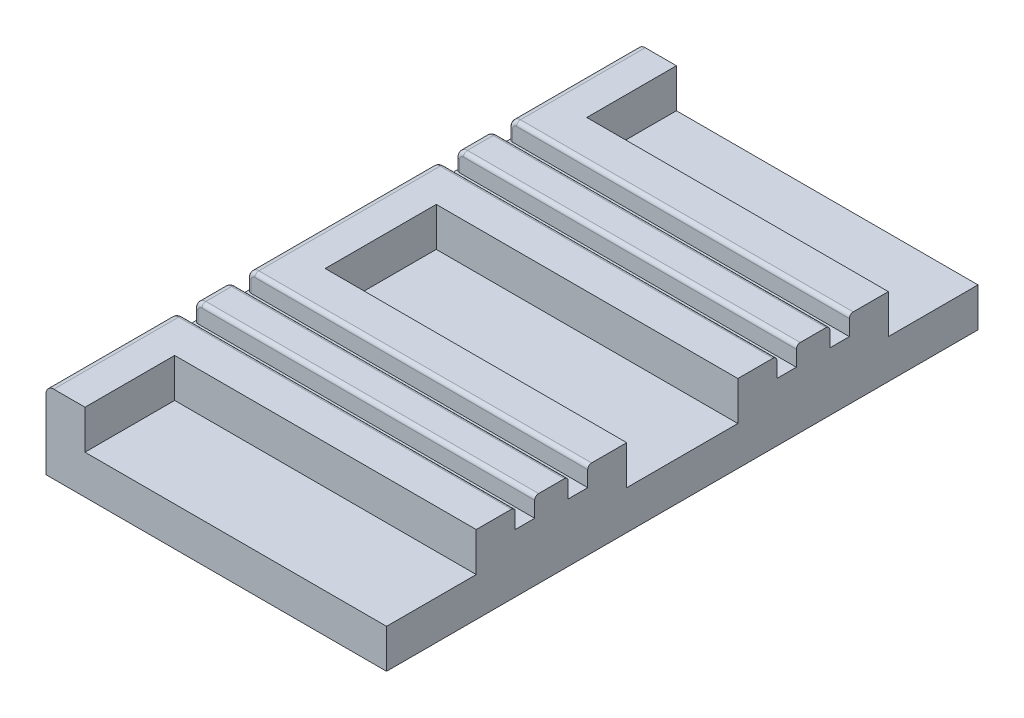
from build123d import *

# Parameters (mm, degrees)
SKETCH1_W                                  = 240
SKETCH1_H                                  = 200
BOSS_EXTRUDE1_DEPTH                        = 20
SKETCH7_W                                  = 120
SKETCH7_H                                  = 50
BOSS_EXTRUDE6_DEPTH                        = 20
FILLET1_R                                  = 2
SKETCH2_W                                  = 39.3
SKETCH2_H                                  = 125.7
CUT_EXTRUDE1_DEPTH                         = 10
CUT_EXTRUDE3_DEPTH                         = 5
MIRROR4_AT_THE_SECOND_PLANE_COPY_1_DEPTH   = 5
SKETCH11_W                                 = 104.748042719
SKETCH11_H                                 = 5
CUT_EXTRUDE4_DEPTH                         = 5
MIRROR6_AT_THE_SECOND_PLANE_COPY_1_SKETC_W = 104.748042719
MIRROR6_AT_THE_SECOND_PLANE_COPY_1_SKETC_H = 5
MIRROR6_AT_THE_SECOND_PLANE_COPY_1_DEPTH   = 5
SHELL1_START                               = 10
SHELL1_OUTLINE_W                           = 80.35
SHELL1_OUTLINE_H                           = 28.5
SHELL1_DEPTH                               = 10
FILLET3_R                                  = 1
SKETCH13_W                                 = 7.252545243
SKETCH13_H                                 = 2.335565418
SKETCH13_W_2                               = 1.720942939
SKETCH13_H_2                               = 2.581414408
CUT_EXTRUDE5_DEPTH                         = 2
CUT_EXTRUDE6_DEPTH                         = 10
MIRROR7_AT_THE_SECOND_PLANE_COPY_1_DEPTH   = 10
SKETCH15_W                                 = 101.789001661
SKETCH15_H                                 = 87.14110882
CUT_EXTRUDE7_DEPTH                         = 194.132079158
SKETCH16_W                                 = 160.143350343
SKETCH16_H                                 = 312.615723006
CUT_EXTRUDE9_DEPTH                         = 194.132079158


# Read off the part's stored shape, not the designer's step: Shell1
with BuildPart() as part:
    # Sketch1 → Boss-Extrude1 (new body)
    with BuildSketch(Plane(origin=(0, 0, 0), x_dir=(1, 0, 0), z_dir=(0, 1, 0))):
        Rectangle(SKETCH1_W, SKETCH1_H)
    extrude(amount=BOSS_EXTRUDE1_DEPTH)

    # Sketch7 → Boss-Extrude6 (add)
    with BuildSketch(Plane(origin=(0, 0, 0), x_dir=(1, 0, 0), z_dir=(0, 1, 0))):
        with Locations((0, 125)):
            Rectangle(SKETCH7_W, SKETCH7_H)
        with Locations((0, -125)):
            Rectangle(SKETCH7_W, SKETCH7_H)
    extrude(amount=BOSS_EXTRUDE6_DEPTH)

    # Fillet1
    fillet1_edges = [part.edges().sort_by_distance(p)[0] for p in [
        (-120, 20, 0),
        (90, 20, 100),
        (-90, 20, 100),
        (-60, 10, 150),
        (60, 10, 150),
        (-60, 20, 125),
        (0, 20, 150),
        (60, 20, 125),
        (-90, 20, -100),
        (60, 20, -125),
        (0, 20, -150),
        (60, 10, -150),
        (-60, 10, -150),
        (-60, 20, -125),
        (120, 20, 0),
        (120, 10, 100),
        (-120, 10, 100),
        (-120, 10, -100),
        (120, 10, -100),
        (90, 20, -100),
    ]]
    fillet(fillet1_edges, radius=FILLET1_R)

    # Sketch2 → Cut-Extrude1 (cut)
    with BuildSketch(Plane(origin=(0, 20, 0), x_dir=(1, 0, 0), z_dir=(0, 1, 0))):
        Rectangle(SKETCH2_W, SKETCH2_H)
    extrude(amount=-CUT_EXTRUDE1_DEPTH, mode=Mode.SUBTRACT)

    # Sketch10 → Cut-Extrude3 (cut)
    with BuildSketch(Plane(origin=(0, 20, 0), x_dir=(1, 0, 0), z_dir=(0, 1, 0))):
        Polygon((-9.25, -40.5), (-9.25, -33.162899401), (-4.25, -33.162899401), (-4.25, -40.5), (-4.25, -156.832928994), (-9.25, -156.832928994), align=None)
    cut_extrude3 = extrude(amount=-CUT_EXTRUDE3_DEPTH, mode=Mode.SUBTRACT)

    # Mirror4: Cut-Extrude3 across plane
    add(cut_extrude3.mirror(Plane(origin=(0, 0, 0), x_dir=(0, 0, 1), z_dir=(1, 0, 0))), mode=Mode.SUBTRACT)

    # Mirror4 at the second plane: Cut-Extrude3 across plane
    add(cut_extrude3.mirror(Plane.XY), mode=Mode.SUBTRACT)

    # Mirror4 at the second plane copy 1 sketc → Mirror4 at the second plane copy 1 (cut)
    with BuildSketch(Plane(origin=(0, 20, 0), x_dir=(-1, 0, 0), z_dir=(0, 1, 0))):
        Polygon((-9.25, -40.5), (-9.25, -33.162899401), (-4.25, -33.162899401), (-4.25, -40.5), (-4.25, -156.832928994), (-9.25, -156.832928994), align=None)
    extrude(amount=-MIRROR4_AT_THE_SECOND_PLANE_COPY_1_DEPTH, mode=Mode.SUBTRACT)

    # Sketch11 → Cut-Extrude4 (cut)
    with BuildSketch(Plane(origin=(0, 20, 0), x_dir=(1, 0, 0), z_dir=(0, 1, 0))):
        with Locations((-72.024021359, 26.75)):
            Rectangle(SKETCH11_W, SKETCH11_H)
        with Locations((-72.024021359, 40.35)):
            Rectangle(SKETCH11_W, SKETCH11_H)
    cut_extrude4 = extrude(amount=-CUT_EXTRUDE4_DEPTH, mode=Mode.SUBTRACT)

    # Mirror6: Cut-Extrude4 across plane
    add(cut_extrude4.mirror(Plane.XY), mode=Mode.SUBTRACT)

    # Mirror6 at the second plane: Cut-Extrude4 across plane
    add(cut_extrude4.mirror(Plane(origin=(0, 0, 0), x_dir=(0, 0, 1), z_dir=(1, 0, 0))), mode=Mode.SUBTRACT)

    # Mirror6 at the second plane copy 1 sketc → Mirror6 at the second plane copy 1 (cut)
    with BuildSketch(Plane(origin=(0, 20, 0), x_dir=(-1, 0, 0), z_dir=(0, 1, 0))):
        with Locations((-72.024021359, 26.75)):
            Rectangle(MIRROR6_AT_THE_SECOND_PLANE_COPY_1_SKETC_W, MIRROR6_AT_THE_SECOND_PLANE_COPY_1_SKETC_H)
        with Locations((-72.024021359, 40.35)):
            Rectangle(MIRROR6_AT_THE_SECOND_PLANE_COPY_1_SKETC_W, MIRROR6_AT_THE_SECOND_PLANE_COPY_1_SKETC_H)
    extrude(amount=-MIRROR6_AT_THE_SECOND_PLANE_COPY_1_DEPTH, mode=Mode.SUBTRACT)

    # Shell1 outline → Shell1 (cut)
    with BuildSketch(Plane(origin=(0, 0, 0), x_dir=(1, 0, 0), z_dir=(0, 1, 0)).offset(SHELL1_START)):
        Polygon((-29.65, 72.85), (-19.25, 72.85), (-19.25, 140), (-50, 140), (-50, 90), (-110, 90), (-110, 52.85), (-29.65, 52.85), align=None)
        Polygon((19.25, 72.85), (29.65, 72.85), (29.65, 52.85), (110, 52.85), (110, 90), (50, 90), (50, 140), (19.25, 140), align=None)
        Polygon((-110, -52.85), (-110, -90), (-50, -90), (-50, -140), (-19.25, -140), (-19.25, -72.85), (-29.65, -72.85), (-29.65, -52.85), align=None)
        with Locations((-69.825, 0)):
            Rectangle(SHELL1_OUTLINE_W, SHELL1_OUTLINE_H)
        Polygon((29.65, -72.85), (19.25, -72.85), (19.25, -140), (50, -140), (50, -90), (110, -90), (110, -52.85), (29.65, -52.85), align=None)
        with Locations((69.825, 0)):
            Rectangle(SHELL1_OUTLINE_W, SHELL1_OUTLINE_H)
    extrude(amount=SHELL1_DEPTH, mode=Mode.SUBTRACT)

    # Fillet3
    fillet3_edges = [part.edges().sort_by_distance(p)[0] for p in [
        (-4.25, 16.5, 150),
        (-4.25, 19.414213562, 149.414213562),
        (-9.25, 16.5, 150),
        (-9.25, 19.414213562, 149.414213562),
        (-4.25, 20, 105.425),
        (-9.25, 20, 105.425),
        (-9.25, 19.414213562, -149.414213562),
        (-9.25, 16.5, -150),
        (-9.25, 20, -105.425),
        (-4.25, 16.5, -150),
        (-4.25, 19.414213562, -149.414213562),
        (-4.25, 20, -105.425),
        (9.25, 16.5, 150),
        (9.25, 20, 105.425),
        (9.25, 19.414213562, 149.414213562),
        (4.25, 16.5, 150),
        (4.25, 19.414213562, 149.414213562),
        (4.25, 20, 105.425),
        (4.25, 16.5, -150),
        (4.25, 19.414213562, -149.414213562),
        (9.25, 19.414213562, -149.414213562),
        (9.25, 16.5, -150),
        (4.25, 20, -105.425),
        (9.25, 20, -105.425),
        (-120, 16.5, -24.25),
        (-120, 16.5, -29.25),
        (-119.414213562, 19.414213562, -24.25),
        (-119.414213562, 19.414213562, -29.25),
        (-68.825, 20, -24.25),
        (-68.825, 20, -29.25),
        (-120, 16.5, -37.85),
        (-120, 16.5, -42.85),
        (-68.825, 20, -37.85),
        (-68.825, 20, -42.85),
        (-119.414213562, 19.414213562, -37.85),
        (-119.414213562, 19.414213562, -42.85),
        (68.825, 20, -29.25),
        (119.414213562, 19.414213562, -29.25),
        (119.414213562, 19.414213562, -24.25),
        (68.825, 20, -24.25),
        (120, 16.5, -29.25),
        (120, 16.5, -24.25),
        (68.825, 20, -42.85),
        (119.414213562, 19.414213562, -42.85),
        (119.414213562, 19.414213562, -37.85),
        (68.825, 20, -37.85),
        (120, 16.5, -42.85),
        (120, 16.5, -37.85),
        (-120, 16.5, 29.25),
        (-120, 16.5, 24.25),
        (-68.825, 20, 29.25),
        (-119.414213562, 19.414213562, 29.25),
        (-119.414213562, 19.414213562, 24.25),
        (-68.825, 20, 24.25),
        (-120, 16.5, 42.85),
        (-120, 16.5, 37.85),
        (-68.825, 20, 42.85),
        (-119.414213562, 19.414213562, 42.85),
        (-119.414213562, 19.414213562, 37.85),
        (-68.825, 20, 37.85),
        (120, 16.5, 24.25),
        (120, 16.5, 29.25),
        (119.414213562, 19.414213562, 24.25),
        (119.414213562, 19.414213562, 29.25),
        (68.825, 20, 24.25),
        (68.825, 20, 29.25),
        (120, 16.5, 37.85),
        (120, 16.5, 42.85),
        (68.825, 20, 37.85),
        (68.825, 20, 42.85),
        (119.414213562, 19.414213562, 37.85),
        (119.414213562, 19.414213562, 42.85),
    ]]
    fillet(fillet3_edges, radius=FILLET3_R)

    # Sketch13 → Cut-Extrude5 (cut)
    # profile 1 of 12: a face of its own
    with BuildSketch(Plane(origin=(0, 10, 0), x_dir=(1, 0, 0), z_dir=(0, 1, 0))):
        Polygon((2.787359078, 56.729654742), (2.787359078, 55.37748529), (5, 55.37748529), (5, 53.041919872), (2.787359078, 53.041919872), (2.787359078, 48.247864542), (0.880108701, 48.247864542), (-4.711035156, 52.886343558), (-4.711035156, 55.37748529), (0.943491644, 55.37748529), (0.943491644, 56.729654742), align=None)
        Polygon((0.943491644, 53.041919872), (-2.596349692, 53.041919872), (0.943491644, 50.110938929), align=None, mode=Mode.SUBTRACT)
    # profile 2 of 12: a face of its own
    with BuildSketch(Plane(origin=(0, 10, 0), x_dir=(1, 0, 0), z_dir=(0, 1, 0))):
        with BuildLine():
            Line((5, 47.141544081), (5, 39.520225351))
            Line((5, 39.520225351), (3.409664338, 39.520225351))
            add(Edge.make_bspline(
                [(3.409664338, 39.520225351), (3.190599668, 39.81675512), (2.747057383, 40.417141716), (2.167094132, 41.14339637), (1.704390868, 41.703253096), (1.381972101, 42.083056551), (1.083256561, 42.417759603), (0.887687077, 42.622007507), (0.79559811, 42.718182933)],
                knots=[0, 0, 0, 0, 1.605452287, 3.25057426, 4.046675402, 4.768563423, 5.420146126, 6, 6, 6, 6], degree=3))
            add(Edge.make_bspline(
                [(0.79559811, 42.718182933), (0.732570292, 42.782561984), (0.609352585, 42.908421315), (0.423765416, 43.085974145), (0.244476812, 43.249198615), (0.074088064, 43.400664381), (-0.092796487, 43.534082219), (-0.252790737, 43.654099684), (-0.406497488, 43.759962438), (-0.599845109, 43.881290453), (-0.837875375, 44.00401532), (-1.125540586, 44.112139625), (-1.412736444, 44.178491494), (-1.604945873, 44.187117789), (-1.699385013, 44.191356186)],
                knots=[0, 0, 0, 0, 1.090093853, 2.131104457, 3.107135244, 4.023908394, 4.888948297, 5.691514549, 6.4435893, 7.146498757, 8.452673016, 9.675803408, 10.85804184, 12, 12, 12, 12], degree=3))
            add(Edge.make_bspline(
                [(-1.699385013, 44.191356186), (-1.754483363, 44.189605987), (-1.861179083, 44.186216799), (-2.017224671, 44.167846758), (-2.162681909, 44.132103765), (-2.300488192, 44.087839319), (-2.42643972, 44.024206924), (-2.544199113, 43.950411254), (-2.650531499, 43.859818439), (-2.749307162, 43.758726543), (-2.834556733, 43.642742478), (-2.911599654, 43.517157005), (-2.971430142, 43.377241787), (-3.024398474, 43.226819474), (-3.063653395, 43.063897589), (-3.092633036, 42.889340485), (-3.109905835, 42.703165878), (-3.111960528, 42.574807759), (-3.113016713, 42.508827152)],
                knots=[0, 0, 0, 0, 1.058578686, 2.049894692, 3.010224385, 3.931750511, 4.822578239, 5.71281177, 6.594427321, 7.498813824, 8.420995957, 9.353043897, 10.321837571, 11.3367408, 12.413304787, 13.535187771, 14.732999458, 16, 16, 16, 16], degree=3))
            add(Edge.make_bspline(
                [(-3.113016713, 42.508827152), (-3.110052719, 42.405568465), (-3.104041103, 42.196137688), (-3.053985994, 41.878413923), (-2.980602684, 41.552282773), (-2.873221808, 41.222921491), (-2.74714341, 40.895094854), (-2.596251992, 40.578640505), (-2.438170844, 40.269132893), (-2.314289691, 40.074405983), (-2.252545243, 39.977350819)],
                knots=[0, 0, 0, 0, 0.914703558, 1.855215137, 2.844920106, 3.875005138, 4.922433174, 5.955639304, 6.981056277, 8, 8, 8, 8], degree=3))
            Line((-2.252545243, 39.977350819), (-2.252545243, 39.766074342))
            Line((-2.252545243, 39.766074342), (-4.363389317, 39.766074342))
            add(Edge.make_bspline(
                [(-4.363389317, 39.766074342), (-4.396975153, 39.85152697), (-4.470639347, 40.038951181), (-4.568658946, 40.352153969), (-4.66491051, 40.720660415), (-4.763825821, 41.132864511), (-4.849735205, 41.573321973), (-4.910075419, 42.024211578), (-4.95119256, 42.474770211), (-4.954991729, 42.775713815), (-4.956884148, 42.92561802)],
                knots=[0, 0, 0, 0, 0.681686624, 1.495150967, 2.435076171, 3.509887788, 4.642826517, 5.765734475, 6.887081194, 8, 8, 8, 8], degree=3))
            add(Edge.make_bspline(
                [(-4.956884148, 42.92561802), (-4.954912362, 43.072306092), (-4.951074185, 43.357841566), (-4.914531776, 43.772464491), (-4.853049644, 44.160650299), (-4.769612134, 44.521836328), (-4.662431161, 44.856562797), (-4.529987596, 45.163893905), (-4.371768891, 45.443672956), (-4.191325, 45.69718541), (-3.986517109, 45.920499957), (-3.762299213, 46.116633841), (-3.516918106, 46.283180062), (-3.250583577, 46.417510178), (-2.964907945, 46.521931142), (-2.659732708, 46.596780352), (-2.333869778, 46.641015432), (-2.109911454, 46.646854566), (-1.995172081, 46.649846099)],
                knots=[0, 0, 0, 0, 1.302669921, 2.535710425, 3.693104205, 4.791067539, 5.825099944, 6.810730835, 7.758000335, 8.67487823, 9.568447078, 10.443087854, 11.315285082, 12.19521531, 13.085757283, 14.011200708, 14.981089066, 16, 16, 16, 16], degree=3))
            add(Edge.make_bspline(
                [(-1.995172081, 46.649846099), (-1.918295051, 46.648245135), (-1.764899121, 46.645050664), (-1.536586701, 46.623146341), (-1.311198259, 46.589276583), (-1.089189633, 46.538876948), (-0.870129482, 46.472993238), (-0.653296175, 46.39436831), (-0.439122967, 46.302496277), (-0.229338943, 46.193054838), (-0.018163961, 46.072147599), (0.191952814, 45.932794317), (0.405837655, 45.781094454), (0.620958688, 45.614342324), (0.835471411, 45.430057751), (1.055741697, 45.23549192), (1.273520634, 45.021368665), (1.417594688, 44.872241147), (1.490889788, 44.796375188)],
                knots=[0, 0, 0, 0, 0.907170522, 1.810115022, 2.704515666, 3.595334857, 4.494160497, 5.402400165, 6.316123003, 7.242010315, 8.19323076, 9.186549597, 10.215937183, 11.28746875, 12.397107329, 13.552885457, 14.755074217, 16, 16, 16, 16], degree=3))
            add(Edge.make_bspline(
                [(1.490889788, 44.796375188), (1.669671754, 44.600991906), (2.021428479, 44.216571794), (2.422503942, 43.720261203), (2.710127438, 43.347225494), (2.892573427, 43.11547907), (3.035611297, 42.923413887), (3.11966375, 42.809753418), (3.156132565, 42.760438229)],
                knots=[0, 0, 0, 0, 1.811045763, 3.563265038, 4.362127914, 5.033096026, 5.580478129, 6, 6, 6, 6], degree=3))
            Line((3.156132565, 42.760438229), (3.156132565, 47.141544081))
            Line((3.156132565, 47.141544081), (5, 47.141544081))
        make_face()
    # profile 3 of 12: a face of its own
    with BuildSketch(Plane(origin=(0, 10, 0), x_dir=(1, 0, 0), z_dir=(0, 1, 0))):
        with BuildLine():
            add(Edge.make_bspline(
                [(0.138720336, 37.553433421), (0.339837036, 37.551198694), (0.731017162, 37.546852061), (1.301575539, 37.503210957), (1.839727263, 37.435290008), (2.344336806, 37.340402007), (2.812295891, 37.218717557), (3.235819492, 37.059739443), (3.620265586, 36.877229499), (3.845547684, 36.720963882), (3.955141787, 36.64494457)],
                knots=[0, 0, 0, 0, 1.210994604, 2.355433537, 3.443919748, 4.476135166, 5.446013627, 6.351277171, 7.197937607, 8, 8, 8, 8], degree=3))
            add(Edge.make_bspline(
                [(3.955141787, 36.64494457), (4.057367971, 36.5617232), (4.260610648, 36.396265258), (4.524020765, 36.101981434), (4.745368417, 35.772676286), (4.897303004, 35.472877401), (4.999247268, 35.217133399), (5.063592063, 35.011802969), (5.122267484, 34.796985151), (5.167723638, 34.570405454), (5.201934481, 34.333084121), (5.226664862, 34.085073274), (5.242295446, 33.825562266), (5.244648027, 33.648682389), (5.245848991, 33.558387312)],
                knots=[0, 0, 0, 0, 1.363120718, 2.710110989, 4.070537742, 5.460816644, 6.180869889, 6.918733188, 7.687278466, 8.485437086, 9.309407483, 10.168795045, 11.065191617, 12, 12, 12, 12], degree=3))
            add(Edge.make_bspline(
                [(5.245848991, 33.558387312), (5.241905689, 33.384062955), (5.234297073, 33.047703496), (5.173081199, 32.562988904), (5.069699732, 32.118069919), (4.926806373, 31.711596248), (4.739854178, 31.34454147), (4.516760058, 31.013155063), (4.251279595, 30.717979546), (4.045332533, 30.554230832), (3.94169692, 30.471830054)],
                knots=[0, 0, 0, 0, 1.200851745, 2.317047666, 3.359233085, 4.342911255, 5.278031965, 6.189548012, 7.088953741, 8, 8, 8, 8], degree=3))
            add(Edge.make_bspline(
                [(3.94169692, 30.471830054), (3.829424185, 30.3947628), (3.600170882, 30.2373967), (3.214838014, 30.049115343), (2.792701976, 29.89168932), (2.331256748, 29.768085058), (1.834031119, 29.675388633), (1.301418942, 29.61187027), (0.734794995, 29.570336966), (0.344952566, 29.565716964), (0.144482422, 29.563341204)],
                knots=[0, 0, 0, 0, 0.822750793, 1.680001256, 2.58557045, 3.544707477, 4.565467581, 5.642347189, 6.787615291, 8, 8, 8, 8], degree=3))
            add(Edge.make_bspline(
                [(0.144482422, 29.563341204), (-0.061754837, 29.565532126), (-0.459970452, 29.569762495), (-1.036345286, 29.613069323), (-1.570746564, 29.680774054), (-2.065452333, 29.775711056), (-2.521358164, 29.900947264), (-2.938473361, 30.06222162), (-3.323134476, 30.249194002), (-3.55325365, 30.406272972), (-3.666176943, 30.483354226)],
                knots=[0, 0, 0, 0, 1.242237956, 2.39858964, 3.479780431, 4.485821505, 5.430991799, 6.32348679, 7.177307181, 8, 8, 8, 8], degree=3))
            add(Edge.make_bspline(
                [(-3.666176943, 30.483354226), (-3.769193286, 30.566416838), (-3.974708441, 30.732124775), (-4.238285133, 31.029639616), (-4.461065672, 31.362253167), (-4.645070962, 31.729678272), (-4.784115122, 32.135791847), (-4.885860052, 32.577168574), (-4.944671996, 33.056148657), (-4.952723667, 33.387282789), (-4.956884148, 33.558387312)],
                knots=[0, 0, 0, 0, 0.915406887, 1.826214983, 2.74012738, 3.682217607, 4.664024873, 5.706462388, 6.814877053, 8, 8, 8, 8], degree=3))
            add(Edge.make_bspline(
                [(-4.956884148, 33.558387312), (-4.955682618, 33.64868302), (-4.953320425, 33.826203271), (-4.937576888, 34.086978277), (-4.913381513, 34.337057391), (-4.877300412, 34.575699285), (-4.828262853, 34.80214551), (-4.773499009, 35.018778584), (-4.706561244, 35.224310597), (-4.601886899, 35.480626422), (-4.447267393, 35.781827029), (-4.217150947, 36.109134402), (-3.948246131, 36.405401156), (-3.739143401, 36.569659884), (-3.633525124, 36.652627351)],
                knots=[0, 0, 0, 0, 0.927772364, 1.823989051, 2.683453821, 3.508702832, 4.302191287, 5.063276402, 5.803871599, 6.520953588, 7.906777029, 9.27188215, 10.622021304, 12, 12, 12, 12], degree=3))
            add(Edge.make_bspline(
                [(-3.633525124, 36.652627351), (-3.521300204, 36.729189524), (-3.292789343, 36.885084383), (-2.908970475, 37.068290297), (-2.492360426, 37.225455121), (-2.036263275, 37.346342452), (-1.54437137, 37.439204828), (-1.015826808, 37.505677425), (-0.450933502, 37.546286922), (-0.061742996, 37.551003841), (0.138720336, 37.553433421)],
                knots=[0, 0, 0, 0, 0.826423845, 1.682753026, 2.582377666, 3.535958882, 4.552416628, 5.629628825, 6.779074777, 8, 8, 8, 8], degree=3))
        make_face()
        with BuildLine():
            add(Edge.make_bspline(
                [(0.138720336, 35.094943508), (-0.002794049, 35.093990238), (-0.275052116, 35.092156251), (-0.667644343, 35.074004214), (-1.028464631, 35.048543297), (-1.357952356, 35.010483072), (-1.656192237, 34.961169576), (-1.923473104, 34.900935006), (-2.158488294, 34.828227196), (-2.363936988, 34.745989678), (-2.54162794, 34.64913888), (-2.69467252, 34.537908006), (-2.823572221, 34.410664927), (-2.931286275, 34.270097317), (-3.011274034, 34.111739825), (-3.072443859, 33.941187009), (-3.106785969, 33.754382189), (-3.110895684, 33.625106618), (-3.113016713, 33.558387312)],
                knots=[0, 0, 0, 0, 1.684598718, 3.240982106, 4.677870026, 5.990101975, 7.188004416, 8.275163324, 9.249099904, 10.113910365, 10.905306099, 11.652292794, 12.358339015, 13.054983843, 13.750418457, 14.461547751, 15.206002611, 16, 16, 16, 16], degree=3))
            add(Edge.make_bspline(
                [(-3.113016713, 33.558387312), (-3.110895681, 33.491668012), (-3.106785962, 33.362392453), (-3.072443884, 33.175587552), (-3.011273943, 33.005035023), (-2.931286606, 32.84667649), (-2.823570979, 32.706112772), (-2.694677343, 32.578854684), (-2.541608299, 32.467684345), (-2.363496496, 32.37029911), (-2.157013742, 32.289020864), (-1.921590867, 32.215742751), (-1.654258135, 32.155647372), (-1.355414385, 32.106122047), (-1.024612933, 32.068276855), (-0.661244964, 32.04269777), (-0.266085327, 32.024665897), (0.008090715, 32.022799039), (0.150244508, 32.021831116)],
                knots=[0, 0, 0, 0, 0.791766581, 1.534129826, 2.243261137, 2.936741863, 3.631429404, 4.335491923, 5.08037989, 5.869552125, 6.738971147, 7.710171362, 8.794275798, 9.988812621, 11.304907075, 12.745337551, 14.312534512, 16, 16, 16, 16], degree=3))
            add(Edge.make_bspline(
                [(0.150244508, 32.021831116), (0.289201434, 32.022765136), (0.556986265, 32.024565091), (0.943773412, 32.043063349), (1.30096878, 32.067483158), (1.627502144, 32.109075315), (1.924420257, 32.156514098), (2.190195476, 32.220950105), (2.427221865, 32.292197549), (2.635687527, 32.376524358), (2.816464841, 32.475577579), (2.974492505, 32.586386469), (3.106149375, 32.714997304), (3.215613674, 32.855867424), (3.298888327, 33.012083539), (3.358752163, 33.181622444), (3.396338685, 33.365314373), (3.400067537, 33.492898418), (3.401981557, 33.558387312)],
                knots=[0, 0, 0, 0, 1.658832269, 3.196746878, 4.622488866, 5.931787449, 7.125569234, 8.210133994, 9.194149195, 10.078471196, 10.889203548, 11.650697572, 12.375032472, 13.07829054, 13.77251817, 14.478471121, 15.218999177, 16, 16, 16, 16], degree=3))
            add(Edge.make_bspline(
                [(3.401981557, 33.558387312), (3.400068186, 33.623876875), (3.3963406, 33.751462223), (3.358745104, 33.935144911), (3.298913291, 34.10471679), (3.215521541, 34.260812329), (3.106775331, 34.40178813), (2.97377315, 34.528364287), (2.816557237, 34.639341559), (2.635707586, 34.738476019), (2.42683161, 34.821967534), (2.190341985, 34.897522561), (1.921851262, 34.956560743), (1.624132619, 35.009519497), (1.295502071, 35.045529443), (0.936895825, 35.074962985), (0.547988509, 35.091838226), (0.278306115, 35.093884415), (0.138720336, 35.094943508)],
                knots=[0, 0, 0, 0, 0.778971247, 1.517574904, 2.221693305, 2.914116855, 3.615547377, 4.332711038, 5.092226179, 5.900851692, 6.782875619, 7.766611013, 8.854037796, 10.053520173, 11.366075456, 12.788704916, 14.337855446, 16, 16, 16, 16], degree=3))
        make_face(mode=Mode.SUBTRACT)
    # profile 4 of 12: a face of its own
    with BuildSketch(Plane(origin=(0, 10, 0), x_dir=(1, 0, 0), z_dir=(0, 1, 0))):
        with BuildLine():
            Line((5, 28.211171751), (5, 20.589853021))
            Line((5, 20.589853021), (3.409664338, 20.589853021))
            add(Edge.make_bspline(
                [(3.409664338, 20.589853021), (3.190599668, 20.88638279), (2.747057383, 21.486769386), (2.167094132, 22.21302404), (1.704390868, 22.772880767), (1.381972101, 23.152684221), (1.083256561, 23.487387273), (0.887687077, 23.691635177), (0.79559811, 23.787810603)],
                knots=[0, 0, 0, 0, 1.605452287, 3.25057426, 4.046675402, 4.768563423, 5.420146126, 6, 6, 6, 6], degree=3))
            add(Edge.make_bspline(
                [(0.79559811, 23.787810603), (0.732570292, 23.852189654), (0.609352585, 23.978048985), (0.423765416, 24.155601815), (0.244476812, 24.318826285), (0.074088064, 24.470292051), (-0.092796487, 24.60370989), (-0.252790737, 24.723727355), (-0.406497488, 24.829590108), (-0.599845109, 24.950918123), (-0.837875375, 25.07364299), (-1.125540586, 25.181767295), (-1.412736444, 25.248119164), (-1.604945873, 25.256745459), (-1.699385013, 25.260983856)],
                knots=[0, 0, 0, 0, 1.090093853, 2.131104457, 3.107135244, 4.023908394, 4.888948297, 5.691514549, 6.4435893, 7.146498757, 8.452673016, 9.675803408, 10.85804184, 12, 12, 12, 12], degree=3))
            add(Edge.make_bspline(
                [(-1.699385013, 25.260983856), (-1.754483363, 25.259233658), (-1.861179083, 25.25584447), (-2.017224671, 25.237474428), (-2.162681909, 25.201731435), (-2.300488192, 25.157466989), (-2.42643972, 25.093834595), (-2.544199113, 25.020038924), (-2.650531499, 24.929446109), (-2.749307162, 24.828354213), (-2.834556733, 24.712370148), (-2.911599654, 24.586784675), (-2.971430142, 24.446869457), (-3.024398474, 24.296447144), (-3.063653395, 24.133525259), (-3.092633036, 23.958968155), (-3.109905835, 23.772793548), (-3.111960528, 23.644435429), (-3.113016713, 23.578454822)],
                knots=[0, 0, 0, 0, 1.058578686, 2.049894692, 3.010224385, 3.931750511, 4.822578239, 5.71281177, 6.594427321, 7.498813824, 8.420995957, 9.353043897, 10.321837571, 11.3367408, 12.413304787, 13.535187771, 14.732999458, 16, 16, 16, 16], degree=3))
            add(Edge.make_bspline(
                [(-3.113016713, 23.578454822), (-3.110052719, 23.475196136), (-3.104041103, 23.265765358), (-3.053985994, 22.948041593), (-2.980602684, 22.621910443), (-2.873221808, 22.292549161), (-2.74714341, 21.964722525), (-2.596251992, 21.648268175), (-2.438170844, 21.338760563), (-2.314289691, 21.144033653), (-2.252545243, 21.046978489)],
                knots=[0, 0, 0, 0, 0.914703558, 1.855215137, 2.844920106, 3.875005138, 4.922433174, 5.955639304, 6.981056277, 8, 8, 8, 8], degree=3))
            Line((-2.252545243, 21.046978489), (-2.252545243, 20.835702012))
            Line((-2.252545243, 20.835702012), (-4.363389317, 20.835702012))
            add(Edge.make_bspline(
                [(-4.363389317, 20.835702012), (-4.396975153, 20.92115464), (-4.470639347, 21.108578851), (-4.568658946, 21.421781639), (-4.66491051, 21.790288086), (-4.763825821, 22.202492181), (-4.849735205, 22.642949643), (-4.910075419, 23.093839248), (-4.95119256, 23.544397881), (-4.954991729, 23.845341485), (-4.956884148, 23.99524569)],
                knots=[0, 0, 0, 0, 0.681686624, 1.495150967, 2.435076171, 3.509887788, 4.642826517, 5.765734475, 6.887081194, 8, 8, 8, 8], degree=3))
            add(Edge.make_bspline(
                [(-4.956884148, 23.99524569), (-4.954912362, 24.141933762), (-4.951074185, 24.427469237), (-4.914531776, 24.842092162), (-4.853049644, 25.230277969), (-4.769612134, 25.591463998), (-4.662431161, 25.926190468), (-4.529987596, 26.233521576), (-4.371768891, 26.513300626), (-4.191325, 26.76681308), (-3.986517109, 26.990127627), (-3.762299213, 27.186261512), (-3.516918106, 27.352807733), (-3.250583577, 27.487137848), (-2.964907945, 27.591558812), (-2.659732708, 27.666408023), (-2.333869778, 27.710643103), (-2.109911454, 27.716482236), (-1.995172081, 27.719473769)],
                knots=[0, 0, 0, 0, 1.302669921, 2.535710425, 3.693104205, 4.791067539, 5.825099944, 6.810730835, 7.758000335, 8.67487823, 9.568447078, 10.443087854, 11.315285082, 12.19521531, 13.085757283, 14.011200708, 14.981089066, 16, 16, 16, 16], degree=3))
            add(Edge.make_bspline(
                [(-1.995172081, 27.719473769), (-1.918295051, 27.717872805), (-1.764899121, 27.714678334), (-1.536586701, 27.692774011), (-1.311198259, 27.658904253), (-1.089189633, 27.608504619), (-0.870129482, 27.542620908), (-0.653296175, 27.46399598), (-0.439122967, 27.372123947), (-0.229338943, 27.262682508), (-0.018163961, 27.141775269), (0.191952814, 27.002421987), (0.405837655, 26.850722124), (0.620958688, 26.683969994), (0.835471411, 26.499685422), (1.055741697, 26.30511959), (1.273520634, 26.090996335), (1.417594688, 25.941868817), (1.490889788, 25.866002858)],
                knots=[0, 0, 0, 0, 0.907170522, 1.810115022, 2.704515666, 3.595334857, 4.494160497, 5.402400165, 6.316123003, 7.242010315, 8.19323076, 9.186549597, 10.215937183, 11.28746875, 12.397107329, 13.552885457, 14.755074217, 16, 16, 16, 16], degree=3))
            add(Edge.make_bspline(
                [(1.490889788, 25.866002858), (1.669671754, 25.670619576), (2.021428479, 25.286199464), (2.422503942, 24.789888873), (2.710127438, 24.416853164), (2.892573427, 24.18510674), (3.035611297, 23.993041557), (3.11966375, 23.879381088), (3.156132565, 23.830065899)],
                knots=[0, 0, 0, 0, 1.811045763, 3.563265038, 4.362127914, 5.033096026, 5.580478129, 6, 6, 6, 6], degree=3))
            Line((3.156132565, 23.830065899), (3.156132565, 28.211171751))
            Line((3.156132565, 28.211171751), (5, 28.211171751))
        make_face()
    # profile 5 of 12: a face of its own
    with BuildSketch(Plane(origin=(0, 10, 0), x_dir=(1, 0, 0), z_dir=(0, 1, 0))):
        Polygon((5, 13.583156769), (5, 11.124666856), (-1.524601746, 11.124666856), (2.664434583, 9.338420279), (2.664434583, 7.625160121), (-1.524601746, 5.838913543), (5, 5.838913543), (5, 3.503348126), (-4.711035156, 3.503348126), (-4.711035156, 6.382470298), (0.125275469, 8.549014533), (-4.711035156, 10.709796683), (-4.711035156, 13.583156769), align=None)
    # profile 6 of 12: a face of its own
    with BuildSketch(Plane(origin=(0, 10, 0), x_dir=(1, 0, 0), z_dir=(0, 1, 0))):
        Polygon((5, 1.4136317), (5, -5.593064552), (-4.711035156, -5.593064552), (-4.711035156, 1.4136317), (-2.867167722, 1.4136317), (-2.867167722, -3.134574639), (-1.146224782, -3.134574639), (-1.146224782, 1.044858213), (0.697642652, 1.044858213), (0.697642652, -3.134574639), (3.156132565, -3.134574639), (3.156132565, 1.4136317), align=None)
    # profile 7 of 12: a face of its own
    with BuildSketch(Plane(origin=(0, 10, 0), x_dir=(1, 0, 0), z_dir=(0, 1, 0))):
        with BuildLine():
            add(Edge.make_bspline(
                [(4.475650198, -7.805705474), (4.519354839, -7.923859504), (4.612512661, -8.17570855), (4.743574124, -8.583890089), (4.866671289, -9.047274178), (4.996208031, -9.552124696), (5.106381276, -10.084227717), (5.187397941, -10.625264318), (5.237323662, -11.165972628), (5.243010567, -11.526628491), (5.245848991, -11.706637515)],
                knots=[0, 0, 0, 0, 0.756485239, 1.612472169, 2.573171414, 3.635272123, 4.742182008, 5.834553763, 6.919191659, 8, 8, 8, 8], degree=3))
            add(Edge.make_bspline(
                [(5.245848991, -11.706637515), (5.241962961, -11.909112321), (5.234392087, -12.303579456), (5.17063924, -12.878829296), (5.062937634, -13.419584917), (4.916847086, -13.928231287), (4.72267015, -14.400885619), (4.491042888, -14.842463027), (4.211679163, -15.247896521), (3.893490591, -15.618759753), (3.53655883, -15.9505899), (3.145758166, -16.239699566), (2.72146993, -16.48347792), (2.264846611, -16.681095463), (1.776896349, -16.838089964), (1.255150105, -16.944841813), (0.702111097, -17.014888699), (0.322052776, -17.021601157), (0.127196165, -17.025042647)],
                knots=[0, 0, 0, 0, 1.160705024, 2.261318311, 3.313123859, 4.319096107, 5.290496718, 6.238021168, 7.172737693, 8.107230733, 9.03451477, 9.961071912, 10.888559376, 11.833805606, 12.808979065, 13.821966168, 14.883317984, 16, 16, 16, 16], degree=3))
            add(Edge.make_bspline(
                [(0.127196165, -17.025042647), (-0.058682323, -17.02067815), (-0.422730133, -17.012130168), (-0.955049114, -16.943336637), (-1.460067022, -16.832867692), (-1.937766829, -16.677677821), (-2.386372436, -16.473696921), (-2.808700267, -16.227656485), (-3.203463564, -15.935836699), (-3.565000576, -15.598836264), (-3.895700628, -15.226075236), (-4.177610929, -14.810267907), (-4.422741814, -14.363406013), (-4.616779655, -13.8775432), (-4.772219277, -13.359136807), (-4.876169413, -12.804694831), (-4.946971316, -12.216810998), (-4.953520434, -11.812500101), (-4.956884148, -11.604840667)],
                knots=[0, 0, 0, 0, 1.061573339, 2.079118747, 3.060574866, 4.011305467, 4.942696719, 5.870461571, 6.798745348, 7.740825567, 8.68941507, 9.638984161, 10.604583371, 11.595514188, 12.621960228, 13.691449096, 14.814297672, 16, 16, 16, 16], degree=3))
            add(Edge.make_bspline(
                [(-4.956884148, -11.604840667), (-4.954318925, -11.445386322), (-4.949235323, -11.129389392), (-4.919388643, -10.661251886), (-4.863951384, -10.205248288), (-4.792453594, -9.753475749), (-4.684946461, -9.294730481), (-4.534849919, -8.818874824), (-4.346707534, -8.316660693), (-4.193287983, -7.980233106), (-4.113698935, -7.805705474)],
                knots=[0, 0, 0, 0, 0.974479143, 1.931163549, 2.86485946, 3.780778834, 4.725046501, 5.741022375, 6.828116267, 8, 8, 8, 8], degree=3))
            Line((-4.113698935, -7.805705474), (-1.883771756, -7.805705474))
            Line((-1.883771756, -7.805705474), (-1.883771756, -8.091889065))
            add(Edge.make_bspline(
                [(-1.883771756, -8.091889065), (-1.906716104, -8.126531064), (-1.957410079, -8.203070203), (-2.043059993, -8.326945943), (-2.137489474, -8.476111594), (-2.284548962, -8.694884397), (-2.45960062, -8.978067997), (-2.581693909, -9.213466955), (-2.640525683, -9.326896107)],
                knots=[0, 0, 0, 0, 0.515980687, 1.140024195, 1.869947604, 2.707876564, 4.413660046, 6, 6, 6, 6], degree=3))
            add(Edge.make_bspline(
                [(-2.640525683, -9.326896107), (-2.672756546, -9.393740863), (-2.73882048, -9.530753251), (-2.823836627, -9.749019276), (-2.905177649, -9.981830174), (-2.978097, -10.22950925), (-3.037034138, -10.489919732), (-3.082413494, -10.759686706), (-3.106467195, -11.03779789), (-3.110821171, -11.225783758), (-3.113016713, -11.320577771)],
                knots=[0, 0, 0, 0, 0.861448091, 1.765719082, 2.717953576, 3.724891765, 4.761927522, 5.816719679, 6.89905606, 8, 8, 8, 8], degree=3))
            add(Edge.make_bspline(
                [(-3.113016713, -11.320577771), (-3.110164997, -11.430782772), (-3.104578279, -11.646682304), (-3.068710383, -11.963218824), (-3.004292393, -12.263584213), (-2.918860854, -12.549882667), (-2.805175217, -12.820581595), (-2.662381265, -13.075068024), (-2.499039638, -13.320076357), (-2.36711736, -13.466852812), (-2.300562624, -13.540901474)],
                knots=[0, 0, 0, 0, 1.091217493, 2.137773647, 3.148547478, 4.129133693, 5.092188092, 6.048375109, 7.015406034, 8, 8, 8, 8], degree=3))
            add(Edge.make_bspline(
                [(-2.300562624, -13.540901474), (-2.231129169, -13.608753509), (-2.090799964, -13.745886571), (-1.846186727, -13.91943259), (-1.579009792, -14.07619004), (-1.283734201, -14.208811415), (-0.962723927, -14.314570988), (-0.616833633, -14.387928819), (-0.248028071, -14.435679856), (0.006035391, -14.440927383), (0.136799641, -14.443628239)],
                knots=[0, 0, 0, 0, 0.871242595, 1.760833901, 2.686460846, 3.652134751, 4.663748384, 5.717797841, 6.825370436, 8, 8, 8, 8], degree=3))
            add(Edge.make_bspline(
                [(0.136799641, -14.443628239), (0.270078203, -14.441217619), (0.528956778, -14.436535262), (0.904701948, -14.395518364), (1.257245759, -14.329288021), (1.585144219, -14.233472949), (1.889752999, -14.11198958), (2.170660406, -13.964565335), (2.424839249, -13.78559248), (2.657673098, -13.584235453), (2.862193118, -13.352834409), (3.041867765, -13.096983341), (3.191530728, -12.813783401), (3.315763592, -12.506455713), (3.407777269, -12.172177215), (3.477785429, -11.813452581), (3.51753353, -11.428392977), (3.522401475, -11.163169785), (3.524906052, -11.026711399)],
                knots=[0, 0, 0, 0, 1.162877018, 2.258757441, 3.29433279, 4.289818334, 5.235063129, 6.152415668, 7.05144509, 7.94239879, 8.832861761, 9.739671241, 10.664582224, 11.622279774, 12.626959197, 13.685538709, 14.809200461, 16, 16, 16, 16], degree=3))
            add(Edge.make_bspline(
                [(3.524906052, -11.026711399), (3.524545414, -10.976125561), (3.523787414, -10.869802624), (3.51698298, -10.707868976), (3.511542352, -10.544994826), (3.50110347, -10.438303115), (3.496095624, -10.387119882)],
                knots=[0, 0, 0, 0, 0.947728294, 1.991965744, 3.036685378, 4, 4, 4, 4], degree=3))
            Line((3.496095624, -10.387119882), (1.435189626, -10.387119882))
            Line((1.435189626, -10.387119882), (1.435189626, -12.353911813))
            Line((1.435189626, -12.353911813), (-0.408677809, -12.353911813))
            Line((-0.408677809, -12.353911813), (-0.408677809, -7.805705474))
            Line((-0.408677809, -7.805705474), (4.475650198, -7.805705474))
        make_face()
    # profile 8 of 12: a face of its own
    with BuildSketch(Plane(origin=(0, 10, 0), x_dir=(1, 0, 0), z_dir=(0, 1, 0))):
        with Locations((1.373727378, -19.913768295)):
            Rectangle(SKETCH13_W, SKETCH13_H)
    # profile 9 of 12: a face of its own
    with BuildSketch(Plane(origin=(0, 10, 0), x_dir=(1, 0, 0), z_dir=(0, 1, 0))):
        with Locations((-4.219337174, -19.913768295)):
            Rectangle(SKETCH13_W_2, SKETCH13_H_2)
    # profile 10 of 12: a face of its own
    with BuildSketch(Plane(origin=(0, 10, 0), x_dir=(1, 0, 0), z_dir=(0, 1, 0))):
        with BuildLine():
            add(Edge.make_bspline(
                [(5.245848991, -30.773379208), (5.241556228, -30.949600555), (5.233101922, -31.296656552), (5.17328717, -31.807137753), (5.071443943, -32.296870987), (4.929457053, -32.76358831), (4.750483589, -33.205121013), (4.527408056, -33.614715808), (4.267338932, -33.994815031), (4.061606502, -34.220067298), (3.958983177, -34.332427496)],
                knots=[0, 0, 0, 0, 1.089850102, 2.146385891, 3.173869964, 4.179760968, 5.160008291, 6.115072822, 7.059761785, 8, 8, 8, 8], degree=3))
            add(Edge.make_bspline(
                [(3.958983177, -34.332427496), (3.848038568, -34.438295465), (3.624492228, -34.651612698), (3.240912088, -34.92404395), (2.819806379, -35.161121156), (2.440058042, -35.326067869), (2.118408243, -35.437370727), (1.865302565, -35.510926057), (1.602961267, -35.571890876), (1.331038558, -35.621175666), (1.050675199, -35.662875321), (0.76008365, -35.687900337), (0.460358885, -35.70657835), (0.257194686, -35.708560179), (0.154085898, -35.709565986)],
                knots=[0, 0, 0, 0, 1.326589366, 2.672993315, 4.060770367, 5.505883836, 6.25107509, 7.007321983, 7.7873399, 8.582269437, 9.400071632, 10.240855478, 11.107208546, 12, 12, 12, 12], degree=3))
            add(Edge.make_bspline(
                [(0.154085898, -35.709565986), (-0.036260272, -35.705853317), (-0.409159179, -35.698579988), (-0.954067146, -35.631518817), (-1.472101576, -35.524248732), (-1.962272567, -35.375865598), (-2.421254864, -35.182794221), (-2.847342954, -34.951680217), (-3.242424741, -34.683652344), (-3.47520079, -34.471076121), (-3.591269829, -34.365079315)],
                knots=[0, 0, 0, 0, 1.119324668, 2.1928203, 3.223958197, 4.228260008, 5.200520162, 6.147632129, 7.076354466, 8, 8, 8, 8], degree=3))
            add(Edge.make_bspline(
                [(-3.591269829, -34.365079315), (-3.696426816, -34.256022231), (-3.907914238, -34.036691095), (-4.17855444, -33.660997219), (-4.413868173, -33.249571895), (-4.610724175, -32.802820982), (-4.765892728, -32.325941651), (-4.877010675, -31.82562766), (-4.943259501, -31.303347455), (-4.952287649, -30.948354573), (-4.956884148, -30.767617122)],
                knots=[0, 0, 0, 0, 0.919195442, 1.8486482, 2.803167129, 3.793795735, 4.808307604, 5.844199062, 6.902417522, 8, 8, 8, 8], degree=3))
            add(Edge.make_bspline(
                [(-4.956884148, -30.767617122), (-4.956393428, -30.668359933), (-4.955436829, -30.474869682), (-4.94084827, -30.191814102), (-4.921289403, -29.923828157), (-4.879474294, -29.592200908), (-4.814808823, -29.204474119), (-4.7421777, -28.904822537), (-4.707193766, -28.760490591)],
                knots=[0, 0, 0, 0, 0.880714095, 1.716848845, 2.514717796, 3.264532192, 4.682418473, 6, 6, 6, 6], degree=3))
            add(Edge.make_bspline(
                [(-4.707193766, -28.760490591), (-4.664108705, -28.621612355), (-4.581310973, -28.354726269), (-4.434982607, -27.98111963), (-4.28414942, -27.652264541), (-4.186257609, -27.446632632), (-4.140588669, -27.350700282)],
                knots=[0, 0, 0, 0, 1.146660616, 2.203568899, 3.161920647, 4, 4, 4, 4], degree=3))
            Line((-4.140588669, -27.350700282), (-1.760847261, -27.350700282))
            Line((-1.760847261, -27.350700282), (-1.760847261, -27.636883873))
            add(Edge.make_bspline(
                [(-1.760847261, -27.636883873), (-1.789760882, -27.669445598), (-1.850028949, -27.737317837), (-1.943169449, -27.84646079), (-2.044289807, -27.966859077), (-2.193791638, -28.146156267), (-2.382825876, -28.396964235), (-2.52216278, -28.612309765), (-2.594428997, -28.723997382)],
                knots=[0, 0, 0, 0, 0.571444814, 1.191129738, 1.882836886, 2.634784766, 4.254652092, 6, 6, 6, 6], degree=3))
            add(Edge.make_bspline(
                [(-2.594428997, -28.723997382), (-2.664236929, -28.846886536), (-2.805685787, -29.09589163), (-2.943550161, -29.429418426), (-3.032587435, -29.709146116), (-3.077362003, -29.929392289), (-3.107853006, -30.156624515), (-3.111280534, -30.311028434), (-3.113016713, -30.389240159)],
                knots=[0, 0, 0, 0, 1.439173741, 2.916136845, 3.667290802, 4.427345131, 5.203387771, 6, 6, 6, 6], degree=3))
            add(Edge.make_bspline(
                [(-3.113016713, -30.389240159), (-3.110477824, -30.475745648), (-3.105440763, -30.647369353), (-3.07497042, -30.902187581), (-3.020147889, -31.150575186), (-2.946619655, -31.393340851), (-2.845477271, -31.627774464), (-2.718252775, -31.853674636), (-2.562057311, -32.070037457), (-2.439651919, -32.20231689), (-2.377390434, -32.269600803)],
                knots=[0, 0, 0, 0, 1.001598119, 1.9871338, 2.96553644, 3.943152672, 4.919306753, 5.914963555, 6.939446524, 8, 8, 8, 8], degree=3))
            add(Edge.make_bspline(
                [(-2.377390434, -32.269600803), (-2.309583745, -32.332034441), (-2.171025631, -32.45961311), (-1.93152049, -32.625206542), (-1.660665123, -32.770051169), (-1.360441958, -32.900067806), (-1.026703819, -33.004078191), (-0.659549693, -33.075068855), (-0.259970233, -33.119887624), (0.017588233, -33.125326369), (0.161768679, -33.128151577)],
                knots=[0, 0, 0, 0, 0.80388915, 1.642689914, 2.53299325, 3.481872775, 4.4947599, 5.577680681, 6.741702658, 8, 8, 8, 8], degree=3))
            add(Edge.make_bspline(
                [(0.161768679, -33.128151577), (0.311768837, -33.125923628), (0.599876693, -33.121644368), (1.011428999, -33.069407329), (1.386636838, -32.994288328), (1.721395513, -32.879071876), (2.020823568, -32.741957475), (2.287301408, -32.588864868), (2.521133588, -32.418332338), (2.653723475, -32.287257692), (2.71821405, -32.223504117)],
                knots=[0, 0, 0, 0, 1.290334302, 2.478367041, 3.565730986, 4.578276722, 5.517838544, 6.396912514, 7.220272109, 8, 8, 8, 8], degree=3))
            add(Edge.make_bspline(
                [(2.71821405, -32.223504117), (2.776624204, -32.15678903), (2.892154246, -32.024832576), (3.038823686, -31.808811236), (3.156499876, -31.579934787), (3.248205125, -31.341825956), (3.315689405, -31.098752861), (3.366730598, -30.856410279), (3.396189151, -30.615336617), (3.400060024, -30.45525906), (3.401981557, -30.375795292)],
                knots=[0, 0, 0, 0, 1.054325691, 2.085361559, 3.097224921, 4.110091334, 5.115626892, 6.095649915, 7.054665517, 8, 8, 8, 8], degree=3))
            add(Edge.make_bspline(
                [(3.401981557, -30.375795292), (3.399995416, -30.300167635), (3.396010997, -30.148450175), (3.367969377, -29.92183692), (3.324531763, -29.696128902), (3.260202951, -29.473850088), (3.18176618, -29.256712893), (3.091757836, -29.045457401), (2.985752349, -28.843934907), (2.905928292, -28.715220777), (2.866107583, -28.651010962)],
                knots=[0, 0, 0, 0, 0.991289386, 1.988636345, 2.989438367, 4.001683697, 5.01851186, 6.01479875, 7.009670459, 8, 8, 8, 8], degree=3))
            add(Edge.make_bspline(
                [(2.866107583, -28.651010962), (2.799086235, -28.54754028), (2.667016335, -28.343644611), (2.482727048, -28.10690862), (2.33514417, -27.932313621), (2.23417018, -27.813138173), (2.139586208, -27.707238781), (2.078704196, -27.641290482), (2.049812104, -27.60999414)],
                knots=[0, 0, 0, 0, 1.674278229, 3.299273488, 4.071081905, 4.780574956, 5.421311183, 6, 6, 6, 6], degree=3))
            Line((2.049812104, -27.60999414), (2.049812104, -27.350700282))
            Line((2.049812104, -27.350700282), (4.400743084, -27.350700282))
            add(Edge.make_bspline(
                [(4.400743084, -27.350700282), (4.453977989, -27.469107265), (4.557995254, -27.700466195), (4.710217804, -28.043257711), (4.853488894, -28.385337096), (4.925202683, -28.621478965), (4.961586095, -28.741283639)],
                knots=[0, 0, 0, 0, 1.037949104, 2.028079651, 2.999562103, 4, 4, 4, 4], degree=3))
            add(Edge.make_bspline(
                [(4.961586095, -28.741283639), (5.004421769, -28.893824294), (5.086847599, -29.1873481), (5.164067273, -29.560966602), (5.209771736, -29.869797121), (5.23105018, -30.136648007), (5.244470102, -30.442236078), (5.245371714, -30.658760047), (5.245848991, -30.773379208)],
                knots=[0, 0, 0, 0, 1.383532347, 2.662238992, 3.328886368, 4.109040656, 4.999001483, 6, 6, 6, 6], degree=3))
        make_face()
    # profile 11 of 12: a face of its own
    with BuildSketch(Plane(origin=(0, 10, 0), x_dir=(1, 0, 0), z_dir=(0, 1, 0))):
        with BuildLine():
            add(Edge.make_bspline(
                [(2.021001676, -36.938810942), (2.135834195, -36.941779245), (2.360423317, -36.947584644), (2.687160369, -37.003329886), (2.994969738, -37.09114997), (3.282415269, -37.214700456), (3.547482787, -37.370068437), (3.793917062, -37.547462735), (4.012640519, -37.757602713), (4.139226852, -37.914392754), (4.202911474, -37.993272632)],
                knots=[0, 0, 0, 0, 1.09475917, 2.141126953, 3.152168046, 4.142704369, 5.117043167, 6.078545687, 7.033330935, 8, 8, 8, 8], degree=3))
            add(Edge.make_bspline(
                [(4.202911474, -37.993272632), (4.271430436, -38.089328613), (4.40755836, -38.280164856), (4.576639788, -38.587433573), (4.713481332, -38.908937379), (4.823111743, -39.248810358), (4.903771308, -39.619354907), (4.959791089, -40.029680334), (4.994197282, -40.485748637), (4.998006227, -40.805105318), (5, -40.972270956)],
                knots=[0, 0, 0, 0, 0.900219365, 1.788482918, 2.670971805, 3.564424711, 4.510769046, 5.562163026, 6.723926581, 8, 8, 8, 8], degree=3))
            Line((5, -40.972270956), (5, -45.174752151))
            Line((5, -45.174752151), (-4.711035156, -45.174752151))
            Line((-4.711035156, -45.174752151), (-4.711035156, -41.425555034))
            add(Edge.make_bspline(
                [(-4.711035156, -41.425555034), (-4.710541486, -41.331439942), (-4.70958769, -41.149604829), (-4.705841049, -40.887095211), (-4.699877008, -40.643807445), (-4.693192491, -40.420271668), (-4.681063463, -40.216067051), (-4.668157953, -40.032247924), (-4.652477333, -39.867707729), (-4.630893633, -39.673277593), (-4.585539799, -39.443346024), (-4.510417909, -39.173669198), (-4.412392074, -38.905016505), (-4.330200075, -38.730862363), (-4.288482202, -38.642467624)],
                knots=[0, 0, 0, 0, 1.191100834, 2.301266995, 3.32247628, 4.271027234, 5.131271201, 5.911180066, 6.602939548, 7.223035301, 8.386250696, 9.563798057, 10.763466492, 12, 12, 12, 12], degree=3))
            add(Edge.make_bspline(
                [(-4.288482202, -38.642467624), (-4.24037863, -38.555082717), (-4.14649073, -38.384526039), (-3.96681891, -38.160482297), (-3.766354069, -37.969249234), (-3.540529018, -37.816186883), (-3.294523859, -37.699130329), (-3.031217773, -37.613886068), (-2.750649461, -37.563414018), (-2.558140696, -37.556803917), (-2.45998033, -37.553433421)],
                knots=[0, 0, 0, 0, 1.062471767, 2.073717987, 3.049750995, 4.008349348, 4.970663542, 5.946983296, 6.953165217, 8, 8, 8, 8], degree=3))
            add(Edge.make_bspline(
                [(-2.45998033, -37.553433421), (-2.34632125, -37.557744982), (-2.123212386, -37.56620843), (-1.799163202, -37.636330667), (-1.497547426, -37.755993777), (-1.217510903, -37.917931504), (-0.962107245, -38.123087774), (-0.737146443, -38.36942586), (-0.539239297, -38.653150081), (-0.437787245, -38.864281752), (-0.385629466, -38.972827206)],
                knots=[0, 0, 0, 0, 1.021240063, 2.004659125, 2.963527431, 3.928166968, 4.902700677, 5.896727327, 6.918681, 8, 8, 8, 8], degree=3))
            Line((-0.385629466, -38.972827206), (-0.331849999, -38.972827206))
            add(Edge.make_bspline(
                [(-0.331849999, -38.972827206), (-0.315133952, -38.896322572), (-0.282373011, -38.746384985), (-0.213507173, -38.530709186), (-0.135710337, -38.325903274), (-0.042627342, -38.133886296), (0.060108174, -37.95222046), (0.178686833, -37.784999106), (0.30692412, -37.628215042), (0.449935214, -37.485611469), (0.604749117, -37.357488018), (0.771277187, -37.24414347), (0.951207426, -37.150906864), (1.14137017, -37.070940795), (1.345153065, -37.011582244), (1.560063926, -36.970821996), (1.786533831, -36.941763667), (1.941515264, -36.939811939), (2.021001676, -36.938810942)],
                knots=[0, 0, 0, 0, 1.10181943, 2.159400495, 3.183738525, 4.183475208, 5.160528738, 6.118184526, 7.065606833, 8.008818544, 8.956240851, 9.891148262, 10.838570569, 11.80433507, 12.791067958, 13.819797808, 14.881824444, 16, 16, 16, 16], degree=3))
        make_face()
        with BuildLine():
            add(Edge.make_bspline(
                [(-2.008616947, -40.134847829), (-2.09124687, -40.140597316), (-2.261302737, -40.152430001), (-2.465096768, -40.229199103), (-2.617398636, -40.321814293), (-2.718430914, -40.417582821), (-2.802491285, -40.537481784), (-2.842505816, -40.628911056), (-2.863326331, -40.676483888)],
                knots=[0, 0, 0, 0, 1.37611365, 2.832099971, 3.575724026, 4.338646544, 5.135558161, 6, 6, 6, 6], degree=3))
            add(Edge.make_bspline(
                [(-2.863326331, -40.676483888), (-2.880469479, -40.72417013), (-2.916029188, -40.823084802), (-2.94872072, -40.98465552), (-2.971826297, -41.161780037), (-2.982379957, -41.360128266), (-2.984019117, -41.586254808), (-2.989034583, -41.849372132), (-2.990414961, -42.152857164), (-2.99020396, -42.369256934), (-2.990092217, -42.483858113)],
                knots=[0, 0, 0, 0, 0.667162118, 1.383881808, 2.166847079, 3.020689487, 3.999759839, 5.147588948, 6.489417668, 8, 8, 8, 8], degree=3))
            Line((-2.990092217, -42.483858113), (-2.990092217, -42.716262238))
            Line((-2.990092217, -42.716262238), (-0.900375791, -42.716262238))
            Line((-0.900375791, -42.716262238), (-0.900375791, -42.328281799))
            add(Edge.make_bspline(
                [(-0.900375791, -42.328281799), (-0.900847936, -42.234165701), (-0.901756934, -42.052968806), (-0.905752536, -41.792392548), (-0.910819984, -41.553515408), (-0.920304415, -41.336408066), (-0.933541808, -41.139837111), (-0.960203888, -40.965118006), (-0.996788228, -40.811145546), (-1.034375643, -40.719653209), (-1.052110715, -40.676483888)],
                knots=[0, 0, 0, 0, 1.353556646, 2.605933166, 3.748016522, 4.789499618, 5.731564706, 6.579319284, 7.329672576, 8, 8, 8, 8], degree=3))
            add(Edge.make_bspline(
                [(-1.052110715, -40.676483888), (-1.078045734, -40.62432659), (-1.126824949, -40.526227872), (-1.221120897, -40.399741201), (-1.326351499, -40.301159723), (-1.446667726, -40.235307443), (-1.574159605, -40.189253382), (-1.710236455, -40.157274444), (-1.856291435, -40.137362616), (-1.956690393, -40.1357051), (-2.008616947, -40.134847829)],
                knots=[0, 0, 0, 0, 1.185047103, 2.228865504, 3.19870776, 4.098528262, 5.002595673, 5.955169327, 6.942409244, 8, 8, 8, 8], degree=3))
        make_face(mode=Mode.SUBTRACT)
        with BuildLine():
            add(Edge.make_bspline(
                [(2.026763761, -39.520225351), (1.953023318, -39.522411502), (1.813066197, -39.52656075), (1.616130796, -39.557844442), (1.445067383, -39.613491155), (1.298621824, -39.693085665), (1.174285176, -39.801935168), (1.0706615, -39.94105928), (0.983868523, -40.11095373), (0.942352079, -40.237230881), (0.920443301, -40.303869011)],
                knots=[0, 0, 0, 0, 1.190735269, 2.259979371, 3.208234232, 4.083001629, 4.93316116, 5.855523917, 6.868331482, 8, 8, 8, 8], degree=3))
            add(Edge.make_bspline(
                [(0.920443301, -40.303869011), (0.906744847, -40.356816102), (0.877297832, -40.470634336), (0.849892481, -40.657796969), (0.834020824, -40.87213552), (0.821780201, -41.198149771), (0.823210929, -41.634925024), (0.821460992, -41.990885698), (0.820567148, -42.172705484)],
                knots=[0, 0, 0, 0, 0.524312437, 1.127093368, 1.81100824, 2.585413694, 4.255876569, 6, 6, 6, 6], degree=3))
            Line((0.820567148, -42.172705484), (0.820567148, -42.716262238))
            Line((0.820567148, -42.716262238), (3.279057061, -42.716262238))
            Line((3.279057061, -42.716262238), (3.279057061, -42.535716885))
            add(Edge.make_bspline(
                [(3.279057061, -42.535716885), (3.278974112, -42.451206672), (3.278814497, -42.288588535), (3.279912217, -42.054255856), (3.276233212, -41.83851166), (3.278151037, -41.641944513), (3.274338023, -41.463336919), (3.276045374, -41.303902128), (3.273109661, -41.162417415), (3.271730495, -41.000319704), (3.261895556, -40.813029002), (3.228612943, -40.599036272), (3.178483106, -40.393438891), (3.126331492, -40.264288854), (3.100432403, -40.200151468)],
                knots=[0, 0, 0, 0, 1.290084578, 2.482435477, 3.577096325, 4.583753231, 5.482956203, 6.303919117, 7.01744192, 7.643013823, 8.77878684, 9.876279933, 10.945336299, 12, 12, 12, 12], degree=3))
            add(Edge.make_bspline(
                [(3.100432403, -40.200151468), (3.071771625, -40.139887889), (3.017172805, -40.02508569), (2.916259015, -39.871286631), (2.794668554, -39.752871432), (2.661678362, -39.662072279), (2.515987473, -39.599481173), (2.362113362, -39.552829486), (2.197351176, -39.525972374), (2.084478576, -39.52216974), (2.026763761, -39.520225351)],
                knots=[0, 0, 0, 0, 1.176739053, 2.241689486, 3.223911615, 4.151030007, 5.066033208, 6.009243398, 6.982072299, 8, 8, 8, 8], degree=3))
        make_face(mode=Mode.SUBTRACT)
    # profile 12 of 12: a face of its own
    with BuildSketch(Plane(origin=(0, 10, 0), x_dir=(1, 0, 0), z_dir=(0, 1, 0))):
        with BuildLine():
            add(Edge.make_bspline(
                [(1.512017436, -47.510317568), (1.658117535, -47.513706434), (1.9428832, -47.520311719), (2.357411184, -47.5695508), (2.744982873, -47.656562292), (3.107029839, -47.774612183), (3.441363342, -47.930059691), (3.751964278, -48.116132586), (4.033217485, -48.341116319), (4.288224496, -48.598381297), (4.5168247, -48.887909948), (4.712363571, -49.212568176), (4.877148099, -49.568574773), (5.015348627, -49.955040345), (5.115871512, -50.3760664), (5.193849339, -50.827473253), (5.236960864, -51.311818098), (5.242825893, -51.644854467), (5.245848991, -51.816516306)],
                knots=[0, 0, 0, 0, 1.078483925, 2.102087493, 3.07563418, 4.006804974, 4.907686045, 5.792049102, 6.673413646, 7.559089302, 8.461147502, 9.390096458, 10.350078799, 11.353180003, 12.414700242, 13.541405865, 14.732730623, 16, 16, 16, 16], degree=3))
            add(Edge.make_bspline(
                [(5.245848991, -51.816516306), (5.242819772, -51.988177805), (5.236942866, -52.321213512), (5.193970738, -52.804933579), (5.115991584, -53.255099563), (5.014659113, -53.675222365), (4.87752742, -54.062007781), (4.712871176, -54.418223302), (4.51624682, -54.741586999), (4.288179492, -55.030698426), (4.033899302, -55.288346201), (3.75147891, -55.510143907), (3.443571052, -55.698318074), (3.108347061, -55.850128873), (2.74757355, -55.968687572), (2.361256189, -56.055795601), (1.948018425, -56.105122439), (1.663882602, -56.111667027), (1.517779522, -56.115032264)],
                knots=[0, 0, 0, 0, 1.269417573, 2.462761791, 3.586710223, 4.645434864, 5.654699426, 6.616309069, 7.542788968, 8.446376281, 9.33355328, 10.213474434, 11.09529141, 11.995722662, 12.928471919, 13.899049301, 14.919687896, 16, 16, 16, 16], degree=3))
            Line((1.517779522, -56.115032264), (-4.711035156, -56.115032264))
            Line((-4.711035156, -56.115032264), (-4.711035156, -53.656542351))
            Line((-4.711035156, -53.656542351), (1.387172245, -53.656542351))
            add(Edge.make_bspline(
                [(1.387172245, -53.656542351), (1.469143879, -53.654753254), (1.628192667, -53.651281887), (1.858859241, -53.633577339), (2.072848893, -53.597748315), (2.272029516, -53.55328104), (2.4547094, -53.491810495), (2.620461575, -53.416686258), (2.77098949, -53.330108084), (2.904599747, -53.227374233), (3.023312628, -53.109052565), (3.125598971, -52.974011118), (3.210086887, -52.821379119), (3.282279136, -52.653957703), (3.334269574, -52.467578025), (3.375509757, -52.265592455), (3.397699401, -52.046212521), (3.400524587, -51.894668614), (3.401981557, -51.816516306)],
                knots=[0, 0, 0, 0, 1.249777764, 2.424931999, 3.522345468, 4.554462307, 5.532762845, 6.454315708, 7.324685205, 8.173785143, 9.015675824, 9.872535868, 10.746508943, 11.66914632, 12.645058795, 13.690060112, 14.808747011, 16, 16, 16, 16], degree=3))
            add(Edge.make_bspline(
                [(3.401981557, -51.816516306), (3.400674296, -51.738979381), (3.398150748, -51.589301379), (3.374130292, -51.37303247), (3.338535545, -51.172391116), (3.287897797, -50.986899342), (3.217473982, -50.818948468), (3.135438424, -50.666383082), (3.038459421, -50.529190069), (2.923990148, -50.409636263), (2.793425817, -50.304652914), (2.645688893, -50.213790545), (2.480082864, -50.136937587), (2.295259376, -50.076535285), (2.09395566, -50.026099098), (1.874093338, -49.992230388), (1.636540145, -49.973845268), (1.472355051, -49.970528364), (1.387172245, -49.968807481)],
                knots=[0, 0, 0, 0, 1.177246587, 2.272567755, 3.300601858, 4.27032395, 5.185878586, 6.060498087, 6.896988092, 7.729228332, 8.566000887, 9.434926014, 10.357220516, 11.331999863, 12.383856098, 13.506125206, 14.706123391, 16, 16, 16, 16], degree=3))
            Line((1.387172245, -49.968807481), (-4.711035156, -49.968807481))
            Line((-4.711035156, -49.968807481), (-4.711035156, -47.510317568))
            Line((-4.711035156, -47.510317568), (1.512017436, -47.510317568))
        make_face()
    extrude(amount=-CUT_EXTRUDE5_DEPTH, mode=Mode.SUBTRACT)

    # Sketch14 → Cut-Extrude6 (cut)
    with BuildSketch(Plane(origin=(0, 20, 0), x_dir=(1, 0, 0), z_dir=(0, 1, 0))):
        Polygon((-27.15, 70.35), (-27.15, 62.35), (-19.65, 62.35), (-19.65, 62.85), (-19.15, 62.85), (-19.15, 70.35), align=None)
    cut_extrude6 = extrude(amount=-CUT_EXTRUDE6_DEPTH, mode=Mode.SUBTRACT)

    # Mirror7: Cut-Extrude6 across plane
    add(cut_extrude6.mirror(Plane(origin=(0, 0, 0), x_dir=(0, 0, 1), z_dir=(1, 0, 0))), mode=Mode.SUBTRACT)

    # Mirror7 at the second plane: Cut-Extrude6 across plane
    add(cut_extrude6.mirror(Plane.XY), mode=Mode.SUBTRACT)

    # Mirror7 at the second plane copy 1 sketc → Mirror7 at the second plane copy 1 (cut)
    with BuildSketch(Plane(origin=(0, 20, 0), x_dir=(-1, 0, 0), z_dir=(0, 1, 0))):
        Polygon((-27.15, 70.35), (-27.15, 62.35), (-19.65, 62.35), (-19.65, 62.85), (-19.15, 62.85), (-19.15, 70.35), align=None)
    extrude(amount=-MIRROR7_AT_THE_SECOND_PLANE_COPY_1_DEPTH, mode=Mode.SUBTRACT)

    # Sketch15 → Cut-Extrude7 (cut, through all)
    with BuildSketch(Plane(origin=(0, 20, 0), x_dir=(1, 0, 0), z_dir=(0, 1, 0))):
        with Locations((-83.544500831, 119.42055441)):
            Rectangle(SKETCH15_W, SKETCH15_H)
        with Locations((83.544500831, 119.42055441)):
            Rectangle(SKETCH15_W, SKETCH15_H)
        with Locations((83.544500831, -119.42055441)):
            Rectangle(SKETCH15_W, SKETCH15_H)
        with Locations((-83.544500831, -119.42055441)):
            Rectangle(SKETCH15_W, SKETCH15_H)
    extrude(amount=-CUT_EXTRUDE7_DEPTH, mode=Mode.SUBTRACT)

    # Sketch16 → Cut-Extrude9 (cut, through all)
    with BuildSketch(Plane(origin=(0, 20, 0), x_dir=(1, 0, 0), z_dir=(0, 1, 0))):
        with Locations((47.421675171, -6.307861503)):
            Rectangle(SKETCH16_W, SKETCH16_H)
    extrude(amount=-CUT_EXTRUDE9_DEPTH, mode=Mode.SUBTRACT)


solid = part.part
